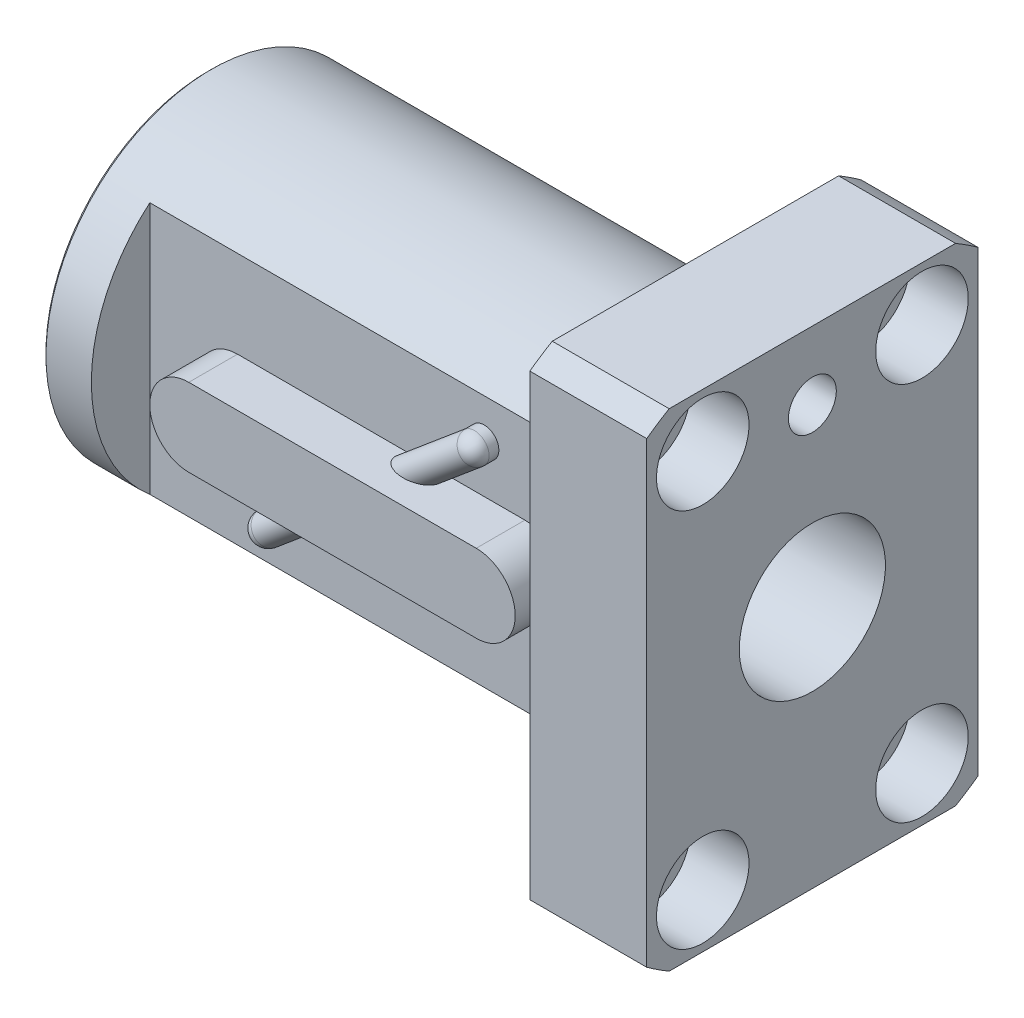
from build123d import *

# Parameters (mm, degrees)
CUT_EXTRUDE1_DEPTH                 = 65.668384857
CHAMFER1_SIZE                      = 0.34
SOCKET_HEAD_CAP_SCREW1_D           = 6
SOCKET_HEAD_CAP_SCREW1_CBORE_D     = 9.5
SOCKET_HEAD_CAP_SCREW1_CBORE_DEPTH = 6
CUT_EXTRUDE2_DEPTH                 = 45
BOSS_EXTRUDE1_DEPTH                = 5
SKETCH7_R                          = 1.5
BOSS_EXTRUDE2_DEPTH                = 1
REVOLVE3_ANGLE                     = 90
REVOLVE4_ANGLE                     = 90
TAP1_START                         = 4.7999999
TAP1_OUTLINE_R                     = 2.4585
TAP1_DEPTH                         = 7.2000001


# Read off the part's stored shape, not the designer's step: Tap1
with BuildPart() as part:
    # Sketch1 → Revolve1 (revolve)
    with BuildSketch(Plane.XY, mode=Mode.PRIVATE) as revolve1_sk:
        Polygon((0, 29), (12, 29), (12, 7.5), (-50, 7.5), (-50, 17), (-0.8, 17), (-0.8, 16.32), (0, 16.32), align=None)
    revolve(revolve1_sk.sketch.rotate(Axis((-50, 0, 0), (1, 0, 0)), 90), axis=Axis((-50, 0, 0), (1, 0, 0)))

    # Sketch2 → Cut-Extrude1 (cut, through all)
    with BuildSketch(Plane(origin=(0, 0, 0), x_dir=(0, 0, -1), z_dir=(1, 0, 0))):
        with BuildLine():
            Line((14.696938457, 25), (-14.696938457, 25))
            ThreePointArc((-14.696938457, 25), (0, 29), (14.696938457, 25))
        make_face()
        with BuildLine():
            Line((17, 23.494680249), (17, -23.494680249))
            ThreePointArc((17, -23.494680249), (29, 0), (17, 23.494680249))
        make_face()
        with BuildLine():
            Line((14.696938457, -25), (-14.696938457, -25))
            ThreePointArc((-14.696938457, -25), (0, -29), (14.696938457, -25))
        make_face()
        with BuildLine():
            Line((-17, -23.494680249), (-17, 23.494680249))
            ThreePointArc((-17, 23.494680249), (-29, 0), (-17, -23.494680249))
        make_face()
    extrude(amount=CUT_EXTRUDE1_DEPTH, mode=Mode.SUBTRACT)

    # Chamfer1
    chamfer1_edges = [part.edges().sort_by_distance(p)[0] for p in [
        (-50, 0, -17),
    ]]
    chamfer(chamfer1_edges, length=CHAMFER1_SIZE)

    # Socket Head Cap Screw1 (through all)
    with Locations(Plane(origin=(12, 0, 0), x_dir=(0, 0, -1), z_dir=(1, 0, 0))):
        with Locations((-11.25, 19.485571585), (11.25, -19.485571585), (-11.25, -19.485571585), (11.25, 19.485571585)):
            CounterBoreHole(SOCKET_HEAD_CAP_SCREW1_D / 2, SOCKET_HEAD_CAP_SCREW1_CBORE_D / 2, SOCKET_HEAD_CAP_SCREW1_CBORE_DEPTH)

    # Sketch5 → Cut-Extrude2 (cut)
    with BuildSketch(Plane(origin=(0, 0, 0), x_dir=(0, 0, -1), z_dir=(1, 0, 0))):
        with BuildLine():
            Line((-11, -12.961481397), (-11, 12.961481397))
            ThreePointArc((-11, 12.961481397), (-17, 0), (-11, -12.961481397))
        make_face()
    extrude(amount=-CUT_EXTRUDE2_DEPTH, mode=Mode.SUBTRACT)

    # Sketch6 → Boss-Extrude1 (add)
    with BuildSketch(Plane(origin=(0, 0, 11), x_dir=(-1, 0, 0), z_dir=(0, 0, -1))):
        with BuildLine():
            Line((6.5, 4), (36, 4))
            ThreePointArc((36, 4), (40, 0), (36, -4))
            Line((36, -4), (6.5, -4))
            ThreePointArc((6.5, -4), (2.5, 0), (6.5, 4))
        make_face()
    extrude(amount=-BOSS_EXTRUDE1_DEPTH)

    # Sketch7 → Boss-Extrude2 (add)
    with BuildSketch(Plane(origin=(0, 0, 11), x_dir=(-1, 0, 0), z_dir=(0, 0, -1))):
        with Locations(Location((31.821413315, -8.870469014, 0), (0, 0, 180))):
            Circle(SKETCH7_R)
        with Locations(Location((10.678586685, 8.870469014, 0), (0, 0, 180))):
            Circle(SKETCH7_R)
    extrude(amount=-BOSS_EXTRUDE2_DEPTH)

    # Sketch8 → Revolve2 (revolve)
    with BuildSketch(Plane.XY.offset(12)):
        Polygon((-31.821413315, -8.870469014), (-10.678586685, 8.870469014), (-11.642768099, 10.019535678), (-32.78559473, -7.721402349), align=None)
    revolve(axis=Axis((-31.821413315, -8.870469014, 12), (0.7660444431189781, 0.6427876096865394, 0)))

    # Sketch9 → Revolve3 (revolve)
    with BuildSketch(Plane.XY.offset(12)):
        with BuildLine():
            Line((-30.857231901, -10.019535678), (-32.78559473, -7.721402349))
            ThreePointArc((-32.78559473, -7.721402349), (-32.97047998, -9.834650428), (-30.857231901, -10.019535678))
        make_face()
    revolve(axis=Axis((-30.857231901, -10.019535678, 12), (-0.6427876096865415, 0.7660444431189763, 0)), revolution_arc=REVOLVE3_ANGLE)

    # Sketch10 → Revolve4 (revolve)
    with BuildSketch(Plane.XY.offset(12)):
        with BuildLine():
            Line((-11.642768099, 10.019535678), (-9.71440527, 7.721402349))
            ThreePointArc((-9.71440527, 7.721402349), (-9.52952002, 9.834650428), (-11.642768099, 10.019535678))
        make_face()
    revolve(axis=Axis((-11.642768099, 10.019535678, 12), (0.6427876096865339, -0.7660444431189826, 0)), revolution_arc=REVOLVE4_ANGLE)

    # Sketch11 → Cut-Revolve1 (revolve, cut)
    with BuildSketch(Plane.XY, mode=Mode.PRIVATE) as cut_revolve1_sk:
        with BuildLine():
            Line((2.3, 0), (4.8, 0))
            Line((4.8, 0), (4.8, 20.4585))
            ThreePointArc((4.8, 20.4585), (3.032233047, 19.726266953), (2.3, 17.9585))
            Line((2.3, 17.9585), (2.3, 0))
        make_face()
    revolve(cut_revolve1_sk.sketch.rotate(Axis((4.8, 0, 0), (0, 1, 0)), 270), axis=Axis((4.8, 0, 0), (0, 1, 0)), mode=Mode.SUBTRACT)

    # Tap1 outline → Tap1 (cut)
    with BuildSketch(Plane.YZ.offset(TAP1_START)):
        with Locations((18, 0)):
            Circle(TAP1_OUTLINE_R)
    extrude(amount=TAP1_DEPTH, mode=Mode.SUBTRACT)


solid = part.part
